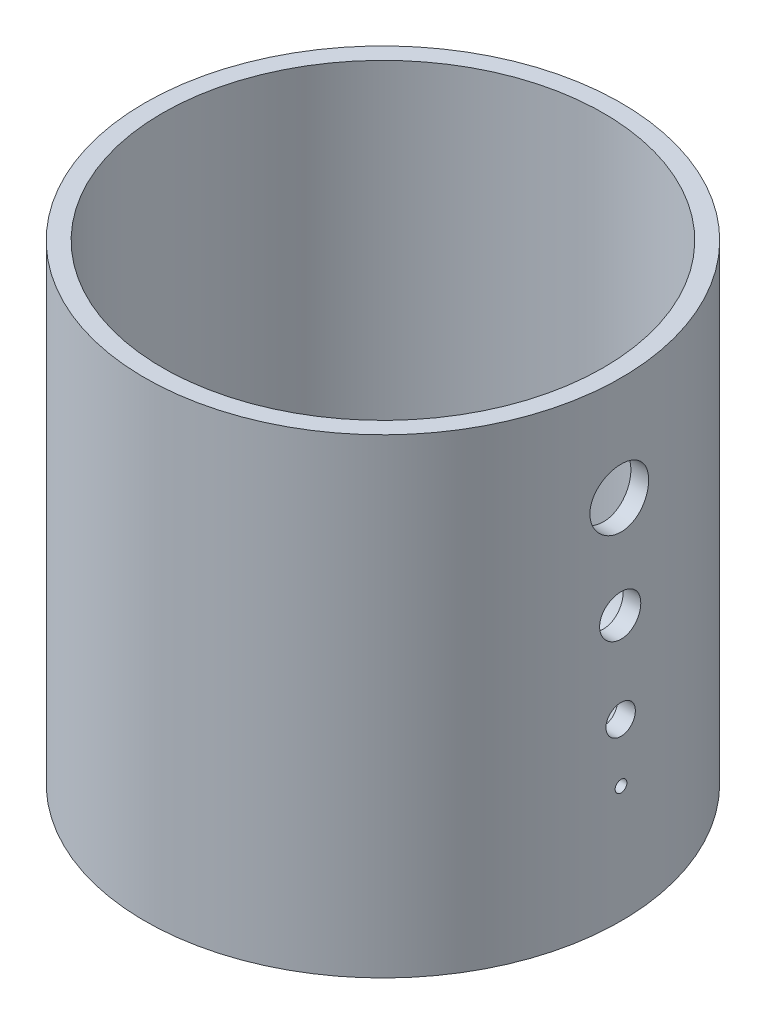
from build123d import *

# Parameters (mm, degrees)
CUT_EXTRUDE2_REACH = 122.836
SKETCH3_R          = 1
SKETCH3_R_2        = 2.5
SKETCH3_R_3        = 3.5
SKETCH3_R_4        = 5


with BuildPart() as part:
    # Sketch1 → Revolve1 (revolve)
    with BuildSketch(Plane.XY):
        with BuildLine():
            Line((0, 0), (-40.5, 0))
            Line((-40.5, 0), (-40.5, 80))
            Line((-40.5, 80), (-37.5, 80))
            Line((-37.5, 80), (-37.5, 15.5))
            ThreePointArc((-37.5, 15.5), (-34.571067812, 8.428932188), (-27.5, 5.5))
            Line((-27.5, 5.5), (0, 5.5))
            Line((0, 5.5), (0, 0))
        make_face()
    revolve(axis=Axis((0, 5.5, 0), (0, -1, 0)))

    # Sketch3 → Cut-Extrude2 (cut, up to next)
    with BuildSketch(Plane(origin=(40.5, 0, 0), x_dir=(0, 0, -1), z_dir=(1, 0, 0)), mode=Mode.PRIVATE) as cut_extrude2_sk1:
        with Locations((0, 19.87603457)):
            Circle(SKETCH3_R)
    cut_extrude2_tool1 = extrude(cut_extrude2_sk1.sketch, amount=-CUT_EXTRUDE2_REACH, mode=Mode.PRIVATE) & part.part
    # Sketch3 → Cut-Extrude2 (cut, up to next)
    with BuildSketch(Plane(origin=(40.5, 0, 0), x_dir=(0, 0, -1), z_dir=(1, 0, 0)), mode=Mode.PRIVATE) as cut_extrude2_sk2:
        with Locations((0, 29.708766717)):
            Circle(SKETCH3_R_2)
    cut_extrude2_tool2 = extrude(cut_extrude2_sk2.sketch, amount=-CUT_EXTRUDE2_REACH, mode=Mode.PRIVATE) & part.part
    # Sketch3 → Cut-Extrude2 (cut, up to next)
    with BuildSketch(Plane(origin=(40.5, 0, 0), x_dir=(0, 0, -1), z_dir=(1, 0, 0)), mode=Mode.PRIVATE) as cut_extrude2_sk3:
        with Locations((0, 45.015390988)):
            Circle(SKETCH3_R_3)
    cut_extrude2_tool3 = extrude(cut_extrude2_sk3.sketch, amount=-CUT_EXTRUDE2_REACH, mode=Mode.PRIVATE) & part.part
    # Sketch3 → Cut-Extrude2 (cut, up to next)
    with BuildSketch(Plane(origin=(40.5, 0, 0), x_dir=(0, 0, -1), z_dir=(1, 0, 0)), mode=Mode.PRIVATE) as cut_extrude2_sk4:
        with Locations((0, 62.298698526)):
            Circle(SKETCH3_R_4)
    cut_extrude2_tool4 = extrude(cut_extrude2_sk4.sketch, amount=-CUT_EXTRUDE2_REACH, mode=Mode.PRIVATE) & part.part
    add(cut_extrude2_tool1.solids().sort_by_distance((40.5, 19.876035, 0))[0], mode=Mode.SUBTRACT)
    add(cut_extrude2_tool2.solids().sort_by_distance((40.5, 29.708767, 0))[0], mode=Mode.SUBTRACT)
    add(cut_extrude2_tool3.solids().sort_by_distance((40.5, 45.015391, 0))[0], mode=Mode.SUBTRACT)
    add(cut_extrude2_tool4.solids().sort_by_distance((40.5, 62.298699, 0))[0], mode=Mode.SUBTRACT)


solid = part.part
